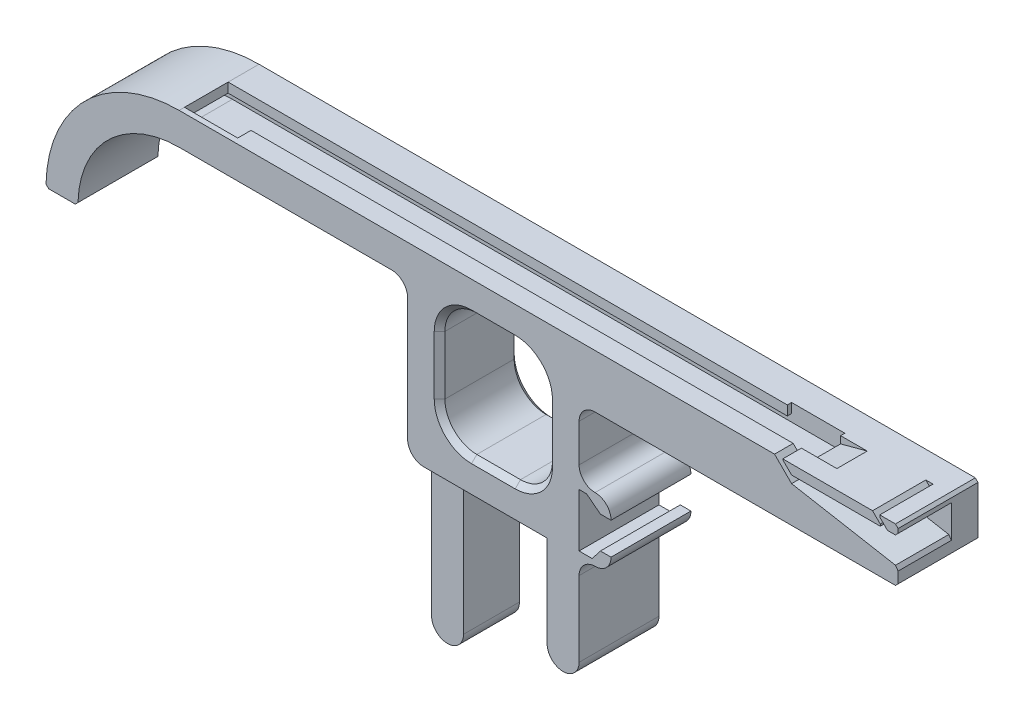
from build123d import *
from OCP.BRepFilletAPI import BRepFilletAPI_MakeChamfer

# Parameters (mm, degrees)
BOSS_EXTRUDE1_DEPTH = 15
BOSS_EXTRUDE2_DEPTH = 15
SKETCH6_W           = 115
SKETCH6_H           = 1.4
CUT_EXTRUDE2_DEPTH  = 10
CUT_EXTRUDE3_DEPTH  = 10
CUT_EXTRUDE4_DEPTH  = 10
BOSS_EXTRUDE3_DEPTH = 1
CUT_EXTRUDE5_REACH  = 117.913
SKETCH10_W          = 115
SKETCH10_H          = 5.7
SKETCH13_W          = 20.2
SKETCH13_H          = 23
CUT_EXTRUDE6_DEPTH  = 111.121977825
FILLET1_R           = 6
SKETCH14_W          = 6
SKETCH14_H          = 31
CUT_EXTRUDE7_DEPTH  = 4.5
FILLET2_R           = 3
SKETCH16_W          = 10
SKETCH16_H          = 2.5
CUT_EXTRUDE8_DEPTH  = 1.8
CHAMFER1_SIZE       = 0.5
CHAMFER1_SIZE_2     = 0.619555405
CHAMFER2_SIZE       = 1
CHAMFER3_SIZE       = 5
CHAMFER3_SIZE2      = 1.339745962
CUT_EXTRUDE12_REACH = 112.118
CHAMFER4_SIZE       = 0.2
CHAMFER4_SIZE_2     = 0.141421356
SKETCH25_W          = 6
SKETCH25_H          = 12
BOSS_EXTRUDE6_DEPTH = 15
FILLET4_START       = -1
FILLET4_DEPTH       = 16
FILLET4_2_DEPTH     = 15
CUT_EXTRUDE15_DEPTH = 15
CUT_EXTRUDE16_DEPTH = 10
CHAMFER5_SIZE       = 0.5
CHAMFER5_SIZE2      = 0.353553391
CHAMFER6_SIZE       = 0.65
SKETCH29_W          = 10
SKETCH29_H          = 0.8
CUT_EXTRUDE17_DEPTH = 3.2


with BuildPart() as part:
    # Sketch3 → Boss-Extrude1 (new body)
    with BuildSketch(Plane.XY):
        Polygon((0, 0), (0, 20.2), (-20.2, 20.2), (-20.2, -10.8), (-26.2, -10.8), (-26.2, 49.2), (-69.1, 49.2), (-69.1, 55.2), (5.9, 55.2), (65.9, 55.2), (65.9, 45.2), (6, 45.2), (6, 0), align=None)
    extrude(amount=BOSS_EXTRUDE1_DEPTH)

    # Sketch4 → Boss-Extrude2 (add)
    with BuildSketch(Plane.XY.offset(15)):
        with BuildLine():
            Line((-88.1, 30.2), (-94.1, 30.2))
            ThreePointArc((-94.1, 30.2), (-86.77766953, 47.87766953), (-69.1, 55.2))
            Line((-69.1, 55.2), (-69.1, 49.2))
            ThreePointArc((-69.1, 49.2), (-82.535028843, 43.635028843), (-88.1, 30.2))
        make_face()
    extrude(amount=-BOSS_EXTRUDE2_DEPTH)

    # Sketch6 → Cut-Extrude2 (cut)
    with BuildSketch(Plane.XY.offset(15)):
        with Locations((-11.6, 52.7)):
            Rectangle(SKETCH6_W, SKETCH6_H)
    extrude(amount=-CUT_EXTRUDE2_DEPTH, mode=Mode.SUBTRACT)

    # Sketch7 → Cut-Extrude3 (cut)
    with BuildSketch(Plane.XY.offset(15)):
        with BuildLine():
            Line((-92.3, 30.2), (-90.9, 30.2))
            ThreePointArc((-90.9, 30.2), (-84.51492783, 45.61492783), (-69.1, 52))
            Line((-69.1, 52), (-69.1, 53.4))
            ThreePointArc((-69.1, 53.4), (-85.504877324, 46.604877324), (-92.3, 30.2))
        make_face()
    extrude(amount=-CUT_EXTRUDE3_DEPTH, mode=Mode.SUBTRACT)

    # Sketch8 → Cut-Extrude4 (cut)
    with BuildSketch(Plane.XY.offset(15)):
        Polygon((45.9, 53.4), (65.9, 53.4), (65.9, 48.4), (45.9, 52), align=None)
    extrude(amount=-CUT_EXTRUDE4_DEPTH, mode=Mode.SUBTRACT)

    # Sketch9 → Boss-Extrude3 (add)
    with BuildSketch(Plane.XY.offset(15)):
        with BuildLine():
            Line((-69.1, 52), (45.9, 52))
            Line((45.9, 52), (45.9, 53.4))
            Line((45.9, 53.4), (-69.1, 53.4))
            ThreePointArc((-69.1, 53.4), (-85.504877324, 46.604877324), (-92.3, 30.2))
            Line((-92.3, 30.2), (-90.9, 30.2))
            ThreePointArc((-90.9, 30.2), (-84.51492783, 45.61492783), (-69.1, 52))
        make_face()
    extrude(amount=-BOSS_EXTRUDE3_DEPTH)

    # Cut-Extrude5: up to this face of the body (flat: up to its plane)
    cut_extrude5_end = Plane(part.part.faces().sort_by_distance((-11.6, 52, 9.5))[0])
    # Sketch10 → Cut-Extrude5 (cut, up to the picked face)
    with BuildSketch(Plane(origin=(0, 55.2, 0), x_dir=(-1, 0, 0), z_dir=(0, 1, 0)), mode=Mode.PRIVATE) as cut_extrude5_sk1:
        with Locations((11.6, 8.65)):
            Rectangle(SKETCH10_W, SKETCH10_H)
    cut_extrude5_tool1 = split(extrude(cut_extrude5_sk1.sketch, amount=-CUT_EXTRUDE5_REACH, mode=Mode.PRIVATE), bisect_by=cut_extrude5_end, keep=Keep.BOTH, mode=Mode.PRIVATE)
    add(cut_extrude5_tool1.solids().sort_by(Axis((-11.6, 55.2, 8.65), (0, -1, 0)))[0], mode=Mode.SUBTRACT)

    # Sketch13 → Cut-Extrude6 (cut, through all)
    with BuildSketch(Plane.XY.offset(15)):
        with Locations((-10.1, 37.7)):
            Rectangle(SKETCH13_W, SKETCH13_H)
    extrude(amount=-CUT_EXTRUDE6_DEPTH, mode=Mode.SUBTRACT)

    # Fillet1
    fillet1_edges = [part.edges().sort_by_distance(p)[0] for p in [
        (-20.2, 26.2, 7.5),
        (-20.2, 49.2, 7.5),
        (0, 49.2, 7.5),
        (0, 26.2, 7.5),
    ]]
    fillet(fillet1_edges, radius=FILLET1_R)

    # Sketch14 → Cut-Extrude7 (cut)
    with BuildSketch(Plane.XY.offset(15)):
        with Locations((-23.2, 4.7)):
            Rectangle(SKETCH14_W, SKETCH14_H)
    extrude(amount=-CUT_EXTRUDE7_DEPTH, mode=Mode.SUBTRACT)

    # Fillet2
    fillet2_edges = [part.edges().sort_by_distance(p)[0] for p in [
        (-26.2, 49.2, 7.5),
        (6, 45.2, 7.5),
        (-26.2, 20.2, 12.75),
        (6, 0, 7.5),
        (0, 0, 7.5),
        (-20.2, -10.8, 5.25),
        (-26.2, -10.8, 5.25),
    ]]
    fillet(fillet2_edges, radius=FILLET2_R - 0.0001)  # a hair under: the kernel refuses the full size

    # Sketch16 → Cut-Extrude8 (cut)
    with BuildSketch(Plane(origin=(0, 55.2, 0), x_dir=(-1, 0, 0), z_dir=(0, 1, 0))):
        with Locations((64.1, 12.75)):
            Rectangle(SKETCH16_W, SKETCH16_H)
    extrude(amount=-CUT_EXTRUDE8_DEPTH, mode=Mode.SUBTRACT)

    # Chamfer1
    # the kernel refuses this chamfer: 0.619555405, 0.5 mm, written as the material it takes off along each edge
    with BuildSketch(Plane(origin=(65.9, 55.2, -1.285841494), x_dir=(-1, 0, 0), z_dir=(0, 0, 1)), Plane(origin=(65.9, 45.2, -1.285841494), x_dir=(0, 1, 0), z_dir=(0, 0, 1))) as chamfer1_piece_1:
        Polygon((CHAMFER1_SIZE, 0), (0, CHAMFER1_SIZE), (0, 0), align=None)
    extrude(amount=17.571682988, mode=Mode.SUBTRACT)
    with BuildSketch(Plane(origin=(-88.1, 30.2, 16.303301327), x_dir=(-1, 0, 0), z_dir=(0, 0, -1))) as chamfer1_piece_2:
        with BuildLine():
            Line((CHAMFER1_SIZE, 0), (-0.006759226, 0.506759226))
            ThreePointArc((-0.006759226, 0.506759226), (-0.001786833, 0.26056951), (0, 0))
            Line((0, 0), (CHAMFER1_SIZE, 0))
        make_face()
    extrude(amount=17.606602654, mode=Mode.SUBTRACT)
    with BuildSketch(Plane(origin=(-94.1, 30.2, 16.285841494), x_dir=(1, 0, 0), z_dir=(0, 0, -1))) as chamfer1_piece_3:
        with BuildLine():
            Line((CHAMFER1_SIZE, 0), (0.004902903, -0.495097097))
            ThreePointArc((0.004902903, -0.495097097), (0.001296043, -0.254559377), (0, 0))
            Line((0, 0), (CHAMFER1_SIZE, 0))
        make_face()
    extrude(amount=17.571682988, mode=Mode.SUBTRACT)
    with BuildSketch(Plane(origin=(65.9, 53.4, 16.285841494), x_dir=(-1, 0, 0), z_dir=(0, 0, -1))) as chamfer1_piece_4:
        Polygon((CHAMFER1_SIZE, 0), (0, CHAMFER1_SIZE), (0, 0), align=None)
    extrude(amount=11.285841494, mode=Mode.SUBTRACT)
    with BuildSketch(Plane(origin=(65.9, 48.4, 16.600156341), x_dir=(-0.9841833239736955, 0.17715299831526463, 0), z_dir=(0, 0, -1))) as chamfer1_piece_5:
        Polygon((CHAMFER1_SIZE, 0), (-CHAMFER1_SIZE_2 * 0.177152998223, -CHAMFER1_SIZE_2 * 0.984183323461), (0, 0), align=None)
    extrude(amount=11.600156341, mode=Mode.SUBTRACT)

    # Chamfer2
    chamfer2_edges = [part.edges().sort_by_distance(p)[0] for p in [
        (-10.1, 49.2, 15),
        (-10.1, 49.2, 0),
        (0, 37.7, 15),
        (0, 37.7, 0),
        (-10.1, 26.2, 15),
        (-10.1, 26.2, 0),
        (-20.2, 37.7, 15),
        (-20.2, 37.7, 0),
        (-1.757359313, 47.442640687, 15),
        (-1.757359313, 47.442640687, 0),
        (-1.757359313, 27.957359313, 15),
        (-1.757359313, 27.957359313, 0),
        (-18.442640687, 27.957359313, 15),
        (-18.442640687, 27.957359313, 0),
        (-18.442640687, 47.442640687, 15),
        (-18.442640687, 47.442640687, 0),
    ]]
    chamfer(chamfer2_edges, length=CHAMFER2_SIZE)

    # Chamfer3
    chamfer3_edges = [part.edges().sort_by_distance(p)[0] for p in [
        (45.9, 55.2, 8.65),
    ]]
    chamfer3_side = [part.faces().sort_by_distance(p)[0] for p in [
        (64.046661535, 55.2, 7.5),
    ]]
    chamfer(chamfer3_edges, length=CHAMFER3_SIZE, length2=CHAMFER3_SIZE2, reference=chamfer3_side[0])

    # Cut-Extrude12: up to this face of the body (flat: up to its plane)
    cut_extrude12_end = Plane(part.part.faces().sort_by_distance((-5.656799941, 54.307895333, 11.5))[0])
    # Sketch20 → Cut-Extrude12 (cut, up to the picked face)
    with BuildSketch(Plane.XY.offset(15), mode=Mode.PRIVATE) as cut_extrude12_sk1:
        Polygon((45.9, 52), (42.7, 55.2), (44.1, 55.2), (45.9, 53.4), align=None)
    cut_extrude12_tool1 = split(extrude(cut_extrude12_sk1.sketch, amount=-CUT_EXTRUDE12_REACH, mode=Mode.PRIVATE), bisect_by=cut_extrude12_end, keep=Keep.BOTH, mode=Mode.PRIVATE)
    add(cut_extrude12_tool1.solids().sort_by(Axis((44.617333, 53.917333, 15), (0, 0, -1)))[0], mode=Mode.SUBTRACT)

    # Chamfer4
    # the kernel refuses this chamfer: 0.2, 0.141421356 mm, written as the material it takes off along each edge
    with BuildSketch(Plane(origin=(44.5, 53.4, 10.985663402), x_dir=(-0.7071067811865476, 0.7071067811865476, 0), z_dir=(0, 0, 1))) as chamfer4_piece_1:
        Polygon((CHAMFER4_SIZE, 0), (CHAMFER4_SIZE_2 * 0.707106782373, CHAMFER4_SIZE_2 * 0.707106782373), (0, 0), align=None)
    extrude(amount=3.014336598, mode=Mode.SUBTRACT)
    with BuildSketch(Plane(origin=(44.1, 55.2, 15.514336598), x_dir=(1, 0, 0), z_dir=(0, 0, -1))) as chamfer4_piece_2:
        Polygon((CHAMFER4_SIZE_2 * 1.00000000168, 0), (CHAMFER4_SIZE * 0.707106781187, CHAMFER4_SIZE * 0.707106781186), (0, 0), align=None)
    extrude(amount=4.528673195, mode=Mode.SUBTRACT)

    # Sketch25 → Boss-Extrude6 (add)
    with BuildSketch(Plane.XY.offset(15)):
        with Locations((9, 26.1)):
            Rectangle(SKETCH25_W, SKETCH25_H)
    extrude(amount=-BOSS_EXTRUDE6_DEPTH)

    # Fillet4: read off the stored shape, not the designer's step
    # Fillet4 outline → Fillet4 (cut)
    with BuildSketch(Plane.XY.offset(FILLET4_START)):
        with BuildLine():
            ThreePointArc((9, 32.1), (11.121320344, 31.221320344), (12, 29.1))
            Line((12, 29.1), (12, 32.1))
            Line((12, 32.1), (9, 32.1))
        make_face()
        with BuildLine():
            ThreePointArc((12, 23.1), (11.121320344, 20.978679656), (9, 20.1))
            Line((9, 20.1), (12, 20.1))
            Line((12, 20.1), (12, 23.1))
        make_face()
    extrude(amount=FILLET4_DEPTH, mode=Mode.SUBTRACT)

    # Fillet4 2 outline → Fillet4 2 (add)
    with BuildSketch(Plane.XY):
        with BuildLine():
            Line((6, 32.1), (9, 32.1))
            ThreePointArc((9, 32.1), (6.878679656, 32.978679656), (6, 35.1))
            Line((6, 35.1), (6, 32.1))
        make_face()
        with BuildLine():
            ThreePointArc((6, 17.1), (6.878679656, 19.221320344), (9, 20.1))
            Line((9, 20.1), (6, 20.1))
            Line((6, 20.1), (6, 17.1))
        make_face()
    extrude(amount=FILLET4_2_DEPTH)

    # Sketch26 → Cut-Extrude15 (cut)
    with BuildSketch(Plane.XY.offset(15)):
        Polygon((12, 29.1), (10, 29.1), (7.402667467, 31.1), (6, 31.1), (6, 21.1), (8.459958458, 21.1), (10, 23.1), (12, 23.1), align=None)
    extrude(amount=-CUT_EXTRUDE15_DEPTH, mode=Mode.SUBTRACT)

    # Sketch27 → Cut-Extrude16 (cut)
    with BuildSketch(Plane.XY.offset(15)):
        Polygon((62.9, 53.4), (61.1, 55.2), (62.1, 55.2), (63.9, 53.4), align=None)
    extrude(amount=-CUT_EXTRUDE16_DEPTH, mode=Mode.SUBTRACT)

    # Chamfer5: one chamfer whose edges measure the first distance from different faces: ONE call of the kernel's chamfer builder (chamfer() names one face for all edges)
    chamfer5_edges_1 = [part.edges().sort_by_distance(p)[0] for p in [
        (62.9, 53.4, 10),
    ]]
    chamfer5_side_1 = [part.faces().sort_by_distance(p)[0] for p in [
        (62, 54.3, 10),
    ]]
    chamfer5_edges_2 = [part.edges().sort_by_distance(p)[0] for p in [
        (62.1, 55.2, 10),
    ]]
    chamfer5_side_2 = [part.faces().sort_by_distance(p)[0] for p in [
        (63, 54.3, 10),
    ]]
    chamfer5 = BRepFilletAPI_MakeChamfer(part.part.solid().wrapped)
    for e in chamfer5_edges_1:
        chamfer5.Add(CHAMFER5_SIZE, CHAMFER5_SIZE2, e.wrapped, chamfer5_side_1[0].wrapped)  # the first distance lies on this face
    for e in chamfer5_edges_2:
        chamfer5.Add(CHAMFER5_SIZE, CHAMFER5_SIZE2, e.wrapped, chamfer5_side_2[0].wrapped)  # the first distance lies on this face
    add(Compound.cast(chamfer5.Shape()), mode=Mode.REPLACE)

    # Chamfer6
    chamfer6_edges = [part.edges().sort_by_distance(p)[0] for p in [
        (-84.51492783, 45.61492783, 14),
        (-85.504877324, 46.604877324, 14),
        (-11.6, 52, 14),
        (-7.370710678, 53.4, 14),
    ]]
    chamfer(chamfer6_edges, length=CHAMFER6_SIZE)

    # Sketch29 → Cut-Extrude17 (cut)
    with BuildSketch(Plane(origin=(0, 55.2, 0), x_dir=(-1, 0, 0), z_dir=(0, 1, 0))):
        with Locations((-40.9, 5.4)):
            Rectangle(SKETCH29_W, SKETCH29_H)
    extrude(amount=-CUT_EXTRUDE17_DEPTH, mode=Mode.SUBTRACT)


solid = part.part
